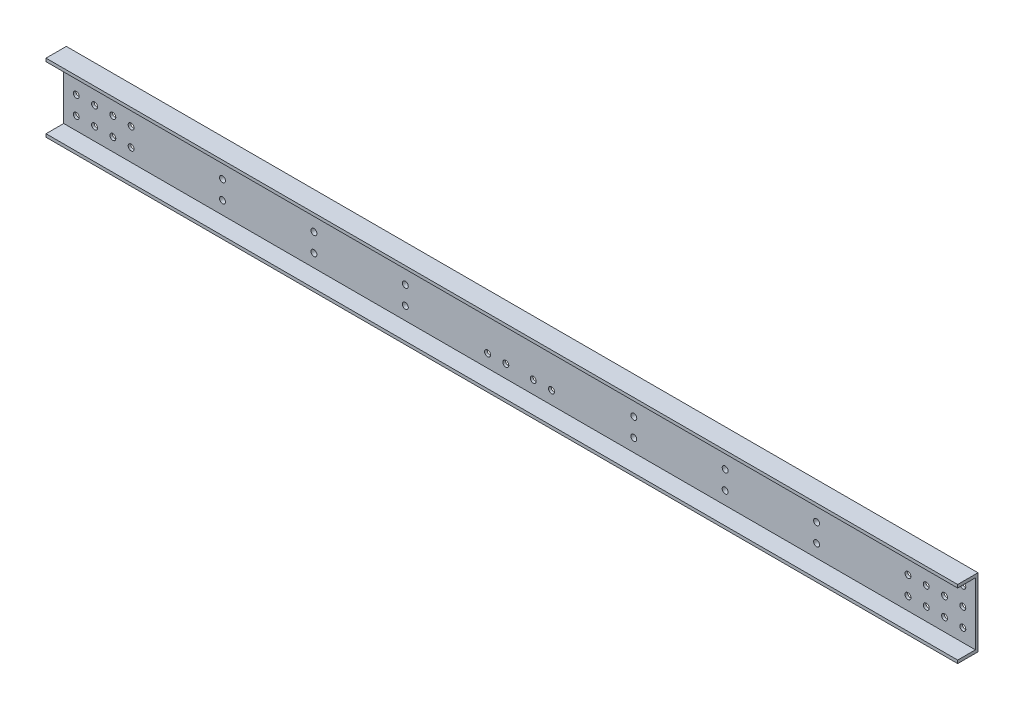
from build123d import *

# Parameters (mm, degrees)
SKETCH_1_W          = 3990
SKETCH_1_H          = 300
SKETCH_1_R          = 13
EXTRUDE_706_DEPTH   = 11.5
SKETCH_2_W          = 3990
SKETCH_2_H          = 13.5
EXTRUDE_1_DEPTH     = 77.5
SKETCH_3_W          = 70
SKETCH_3_H          = 230
EXTRUDE_2_DEPTH     = 16
SKETCH_4_R          = 13
CUT_EXTRUDE_1_DEPTH = 2004.38463606


with BuildPart() as part:
    # 草图1 → Extrude 706 (new body)
    with BuildSketch(Plane.XY):
        Rectangle(SKETCH_1_W, SKETCH_1_H)
        with Locations((1940, 0)):
            Circle(SKETCH_1_R, mode=Mode.SUBTRACT)
        with Locations((1860, 0)):
            Circle(SKETCH_1_R, mode=Mode.SUBTRACT)
        with Locations((1780, 0)):
            Circle(SKETCH_1_R, mode=Mode.SUBTRACT)
        with Locations((1700, 0)):
            Circle(SKETCH_1_R, mode=Mode.SUBTRACT)
        with Locations((1700, 80)):
            Circle(SKETCH_1_R, mode=Mode.SUBTRACT)
        with Locations((1780, 80)):
            Circle(SKETCH_1_R, mode=Mode.SUBTRACT)
        with Locations((1860, 80)):
            Circle(SKETCH_1_R, mode=Mode.SUBTRACT)
        with Locations((1940, 80)):
            Circle(SKETCH_1_R, mode=Mode.SUBTRACT)
        with Locations((1940, -80)):
            Circle(SKETCH_1_R, mode=Mode.SUBTRACT)
        with Locations((1860, -80)):
            Circle(SKETCH_1_R, mode=Mode.SUBTRACT)
        with Locations((1780, -80)):
            Circle(SKETCH_1_R, mode=Mode.SUBTRACT)
        with Locations((1700, -80)):
            Circle(SKETCH_1_R, mode=Mode.SUBTRACT)
        with Locations((-1700, -80)):
            Circle(SKETCH_1_R, mode=Mode.SUBTRACT)
        with Locations((-1780, -80)):
            Circle(SKETCH_1_R, mode=Mode.SUBTRACT)
        with Locations((-1860, -80)):
            Circle(SKETCH_1_R, mode=Mode.SUBTRACT)
        with Locations((-1940, -80)):
            Circle(SKETCH_1_R, mode=Mode.SUBTRACT)
        with Locations((-1940, 80)):
            Circle(SKETCH_1_R, mode=Mode.SUBTRACT)
        with Locations((-1860, 80)):
            Circle(SKETCH_1_R, mode=Mode.SUBTRACT)
        with Locations((-1780, 80)):
            Circle(SKETCH_1_R, mode=Mode.SUBTRACT)
        with Locations((-1700, 80)):
            Circle(SKETCH_1_R, mode=Mode.SUBTRACT)
        with Locations((-1700, 0)):
            Circle(SKETCH_1_R, mode=Mode.SUBTRACT)
        with Locations((-1780, 0)):
            Circle(SKETCH_1_R, mode=Mode.SUBTRACT)
        with Locations((-1860, 0)):
            Circle(SKETCH_1_R, mode=Mode.SUBTRACT)
        with Locations((-1940, 0)):
            Circle(SKETCH_1_R, mode=Mode.SUBTRACT)
        with Locations((60, 80)):
            Circle(SKETCH_1_R, mode=Mode.SUBTRACT)
        with Locations((140, 80)):
            Circle(SKETCH_1_R, mode=Mode.SUBTRACT)
        with Locations((140, -80)):
            Circle(SKETCH_1_R, mode=Mode.SUBTRACT)
        with Locations((60, -80)):
            Circle(SKETCH_1_R, mode=Mode.SUBTRACT)
        with Locations((-60, -80)):
            Circle(SKETCH_1_R, mode=Mode.SUBTRACT)
        with Locations((-140, -80)):
            Circle(SKETCH_1_R, mode=Mode.SUBTRACT)
        with Locations((-140, 80)):
            Circle(SKETCH_1_R, mode=Mode.SUBTRACT)
        with Locations((-60, 80)):
            Circle(SKETCH_1_R, mode=Mode.SUBTRACT)
    extrude(amount=EXTRUDE_706_DEPTH)

    # 草图2 → 凸台-拉伸1 (add)
    with BuildSketch(Plane.XY.offset(11.5)):
        with Locations((0, 143.25)):
            Rectangle(SKETCH_2_W, SKETCH_2_H)
        with Locations((0, -143.25)):
            Rectangle(SKETCH_2_W, SKETCH_2_H)
    extrude(amount=EXTRUDE_1_DEPTH)

    # 草图3 → 凸台-拉伸2 (add)
    with BuildSketch(Plane(origin=(0, 0, 0), x_dir=(-1, 0, 0), z_dir=(0, 0, -1))):
        with Locations((-1300, 0)):
            Rectangle(SKETCH_3_W, SKETCH_3_H)
        with Locations((-900, 0)):
            Rectangle(SKETCH_3_W, SKETCH_3_H)
        with Locations((-500, 0)):
            Rectangle(SKETCH_3_W, SKETCH_3_H)
        with Locations((500, 0)):
            Rectangle(SKETCH_3_W, SKETCH_3_H)
        with Locations((900, 0)):
            Rectangle(SKETCH_3_W, SKETCH_3_H)
        with Locations((1300, 0)):
            Rectangle(SKETCH_3_W, SKETCH_3_H)
    extrude(amount=EXTRUDE_2_DEPTH)

    # 草图4 → 切除-拉伸1 (cut, through all)
    with BuildSketch(Plane(origin=(0, 0, -16), x_dir=(-1, 0, 0), z_dir=(0, 0, -1))):
        with Locations((-1300, 0)):
            Circle(SKETCH_4_R)
        with Locations((-1300, 80)):
            Circle(SKETCH_4_R)
        with Locations((-900, 80)):
            Circle(SKETCH_4_R)
        with Locations((-900, 0)):
            Circle(SKETCH_4_R)
        with Locations((-500, 80)):
            Circle(SKETCH_4_R)
        with Locations((-500, 0)):
            Circle(SKETCH_4_R)
        with Locations((-500, -80)):
            Circle(SKETCH_4_R)
        with Locations((-900, -80)):
            Circle(SKETCH_4_R)
        with Locations((-1300, -80)):
            Circle(SKETCH_4_R)
        with Locations((1300, -80)):
            Circle(SKETCH_4_R)
        with Locations((900, -80)):
            Circle(SKETCH_4_R)
        with Locations((500, -80)):
            Circle(SKETCH_4_R)
        with Locations((500, 0)):
            Circle(SKETCH_4_R)
        with Locations((500, 80)):
            Circle(SKETCH_4_R)
        with Locations((900, 0)):
            Circle(SKETCH_4_R)
        with Locations((900, 80)):
            Circle(SKETCH_4_R)
        with Locations((1300, 80)):
            Circle(SKETCH_4_R)
        with Locations((1300, 0)):
            Circle(SKETCH_4_R)
    extrude(amount=-CUT_EXTRUDE_1_DEPTH, mode=Mode.SUBTRACT)


solid = part.part
